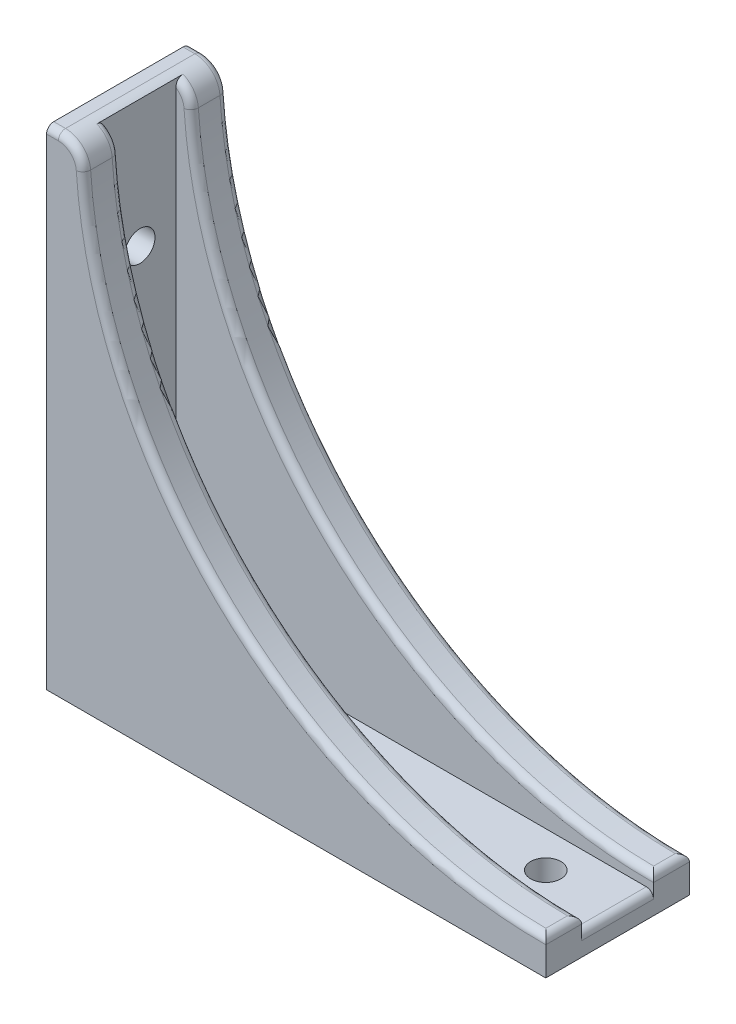
from build123d import *

# Parameters (mm, degrees)
BOSS_EXTRUDE1_DEPTH = 20
CUT_EXTRUDE1_DEPTH  = 15
BOSS_EXTRUDE2_DEPTH = 5
CUT_EXTRUDE2_REACH  = 101.269
SKETCH2_R           = 2.100000000000004
CUT_EXTRUDE3_REACH  = 101.269
SKETCH3_R           = 2.100000000000001
SKETCH3_R_2         = 2.099999999999995
FILLET2_R           = 64
FILLET3_START       = -1
FILLET3_DEPTH       = 22
FILLET3_START_2     = 2.0548
FILLET3_2_DEPTH     = 16
FILLET4_R           = 1


with BuildPart() as part:
    # Sketch1 → Boss-Extrude1 (new body)
    with BuildSketch(Plane.XY):
        Polygon((69.5, 5.000000000000004), (5, 5), (5.000000000000004, 67.99999999999999), (0, 68), (0, 0), (69.49999999999999, 0), align=None)
    extrude(amount=BOSS_EXTRUDE1_DEPTH)

    # Sketch1<3> → Cut-Extrude1 (cut)
    with BuildSketch(Plane.XY):
        Polygon((69.5, 5.000000000000004), (5, 5), (5.000000000000004, 67.99999999999999), (3.0000000000000027, 68), (3.000000000000001, 3), (69.5, 3.000000000000002), align=None)
    extrude(amount=CUT_EXTRUDE1_DEPTH, mode=Mode.SUBTRACT)

    # Sketch1<4> → Boss-Extrude2 (add)
    with BuildSketch(Plane.XY):
        Polygon((69.5, 5.000000000000004), (5, 5), (5.000000000000004, 67.99999999999999), (3.0000000000000027, 68), (3.000000000000001, 3), (69.5, 3.000000000000002), align=None)
    extrude(amount=BOSS_EXTRUDE2_DEPTH)

    # Sketch2 → Cut-Extrude2 (cut, up to next)
    with BuildSketch(Plane.XZ, mode=Mode.PRIVATE) as cut_extrude2_sk1:
        with Locations(Location((59.5, 10, 0), (0, 0, 270))):
            Circle(SKETCH2_R)
    cut_extrude2_tool1 = extrude(cut_extrude2_sk1.sketch, amount=-CUT_EXTRUDE2_REACH, mode=Mode.PRIVATE) & part.part
    add(cut_extrude2_tool1.solids().sort_by_distance((59.5, 0, 10))[0], mode=Mode.SUBTRACT)

    # Sketch3 → Cut-Extrude3 (cut, up to next)
    with BuildSketch(Plane.ZY, mode=Mode.PRIVATE) as cut_extrude3_sk1:
        with Locations((10, 24.999999999999996)):
            Circle(SKETCH3_R)
    cut_extrude3_tool1 = extrude(cut_extrude3_sk1.sketch, amount=-CUT_EXTRUDE3_REACH, mode=Mode.PRIVATE) & part.part
    # Sketch3 → Cut-Extrude3 (cut, up to next)
    with BuildSketch(Plane.ZY, mode=Mode.PRIVATE) as cut_extrude3_sk2:
        with Locations((10, 50)):
            Circle(SKETCH3_R_2)
    cut_extrude3_tool2 = extrude(cut_extrude3_sk2.sketch, amount=-CUT_EXTRUDE3_REACH, mode=Mode.PRIVATE) & part.part
    add(cut_extrude3_tool1.solids().sort_by_distance((0, 25, 10))[0], mode=Mode.SUBTRACT)
    add(cut_extrude3_tool2.solids().sort_by_distance((0, 50, 10))[0], mode=Mode.SUBTRACT)

    # Fillet2
    # the kernel refuses this fillet: 64 mm, written as the material it adds along each edge
    with BuildSketch(Plane(origin=(5.000000000000001, 5, -144.98046755776159), x_dir=(1, 0, 0), z_dir=(0, 0, 1))) as fillet2_piece_1_section:
        with BuildLine():
            CenterArc((63.992187023104634, 64), FILLET2_R, 180.89528298657015, 89.10471701342988)
            Line((6.22e-15, 62.999999999999986), (-1.2798437404620864, 62.97999999999999))
            ThreePointArc((-1.2798437404620864, 62.97999999999999), (-1.2799999999999976, 31.499999999999993), (-1.2800000000000002, 0))
            Line((-1.2800000000000002, 0), (0, -1.2800000000000002))
            Line((0, -1.2800000000000002), (63.992187023104634, -1.2800000000000002))
            Line((63.992187023104634, -1.2800000000000002), (63.992187023104634, 0))
        make_face()
    fillet2_piece_1 = extrude(amount=164.98046755776159, mode=Mode.PRIVATE)
    fillet2_piece_1 = split(fillet2_piece_1, bisect_by=Plane(origin=(5.000000000000001, 5, 0), z_dir=(0, 0, 1)), keep=Keep.TOP, mode=Mode.PRIVATE)
    fillet2_piece_1 = split(fillet2_piece_1, bisect_by=Plane(origin=(5.000000000000001, 5, 5), z_dir=(0, 0, -1)), keep=Keep.TOP, mode=Mode.PRIVATE)
    add(fillet2_piece_1)
    with BuildSketch(Plane(origin=(5.000000000000001, 5, 15), x_dir=(1, 0, 0), z_dir=(0, 0, 1))) as fillet2_piece_2:
        with BuildLine():
            CenterArc((63.992187023104634, 64), FILLET2_R, 180.89528298657015, 89.10471701342988)
            Line((6.22e-15, 62.999999999999986), (-1.2798437404620864, 62.97999999999999))
            ThreePointArc((-1.2798437404620864, 62.97999999999999), (-1.2799999999999976, 31.499999999999993), (-1.2800000000000002, 0))
            Line((-1.2800000000000002, 0), (0, -1.2800000000000002))
            Line((0, -1.2800000000000002), (63.992187023104634, -1.2800000000000002))
            Line((63.992187023104634, -1.2800000000000002), (63.992187023104634, 0))
        make_face()
    extrude(amount=5)
    with BuildSketch(Plane(origin=(5.000000000000001, 5, 0), x_dir=(1, 0, 0), z_dir=(0, 0, 1))) as fillet2_piece_3:
        with BuildLine():
            CenterArc((63.992187023104634, 64), FILLET2_R, 180.89528298657012, 89.10471701342988)
            Line((6.22e-15, 63), (-1.2798437404620864, 62.980000000000004))
            ThreePointArc((-1.2798437404620864, 62.980000000000004), (-1.2799999999999976, 31.5), (-1.2800000000000002, 0))
            Line((-1.2800000000000002, 0), (0, -1.2800000000000002))
            Line((0, -1.2800000000000002), (63.992187023104634, -1.2800000000000002))
            Line((63.992187023104634, -1.2800000000000002), (63.992187023104634, 0))
        make_face()
    extrude(amount=5)
    with BuildSketch(Plane(origin=(5.000000000000001, 5, 0), x_dir=(1, 0, 0), z_dir=(0, 0, 1))) as fillet2_piece_4_section:
        with BuildLine():
            CenterArc((63.992187023104634, 64), FILLET2_R, 180.89528298657012, 89.10471701342988)
            Line((6.22e-15, 63), (-1.2798437404620864, 62.980000000000004))
            ThreePointArc((-1.2798437404620864, 62.980000000000004), (-1.2799999999999976, 31.5), (-1.2800000000000002, 0))
            Line((-1.2800000000000002, 0), (0, -1.2800000000000002))
            Line((0, -1.2800000000000002), (63.992187023104634, -1.2800000000000002))
            Line((63.992187023104634, -1.2800000000000002), (63.992187023104634, 0))
        make_face()
    fillet2_piece_4 = extrude(amount=164.98046755776159, mode=Mode.PRIVATE)
    fillet2_piece_4 = split(fillet2_piece_4, bisect_by=Plane(origin=(5.000000000000001, 5, 15), z_dir=(0, 0, 1)), keep=Keep.TOP, mode=Mode.PRIVATE)
    fillet2_piece_4 = split(fillet2_piece_4, bisect_by=Plane(origin=(5.000000000000001, 5, 20), z_dir=(0, 0, -1)), keep=Keep.TOP, mode=Mode.PRIVATE)
    add(fillet2_piece_4)

    # Fillet3: read off the stored shape, not the designer's step
    # Fillet3 outline → Fillet3 (cut)
    with BuildSketch(Plane.XY.offset(FILLET3_START)):
        with BuildLine():
            ThreePointArc((5.134567622, 64.733333333), (5.046420717, 66.365807229), (5, 68))
            Line((5, 68), (1.642354061, 68))
            ThreePointArc((1.642354061, 68), (4.03330924, 67.056038602), (5.134567622, 64.733333333))
        make_face()
    extrude(amount=FILLET3_DEPTH, mode=Mode.SUBTRACT)

    # Fillet3 2 outline → Fillet3 2 (add)
    with BuildSketch(Plane.XY.offset(FILLET3_START_2)):
        with BuildLine():
            ThreePointArc((6.5, 3), (4.025126266, 4.025126266), (3, 6.5))
            Line((3, 6.5), (3, 3))
            Line((3, 3), (6.5, 3))
        make_face()
    extrude(amount=FILLET3_2_DEPTH)

    # Fillet4
    # the kernel refuses this fillet: 1 mm, written as the material it takes off along each edge
    with BuildSketch(Plane(origin=(1.6423540609999998, 68, 0), x_dir=(0, 0, 1), z_dir=(-1, 0, 0))) as fillet4_piece_1:
        with BuildLine():
            CenterArc((FILLET4_R, -FILLET4_R), FILLET4_R, 90, 90)
            Line((-1.1e-16, -FILLET4_R), (0, 0))
            Line((0, 0), (FILLET4_R, 0))
        make_face()
    extrude(amount=4.142354061, mode=Mode.SUBTRACT)
    with BuildSketch(Plane(origin=(1.6423540609999998, 68, 20), x_dir=(-2.84e-15, -1, 0), z_dir=(-1, 2.84e-15, 0))) as fillet4_piece_2:
        with BuildLine():
            CenterArc((FILLET4_R, -FILLET4_R), FILLET4_R, 90, 90)
            Line((0, -FILLET4_R), (0, 0))
            Line((0, 0), (FILLET4_R, 0))
        make_face()
    extrude(amount=4.142354061, mode=Mode.SUBTRACT)
    with BuildSketch(Plane(origin=(68.992187023105, 69, 0), x_dir=(-2.2e-16, -1, 0), z_dir=(1, -2.2e-16, 0))) as fillet4_piece_3:
        with BuildLine():
            CenterArc((64 + FILLET4_R, -FILLET4_R), FILLET4_R, 90, 90)
            Line((64, -FILLET4_R), (64, 0))
            Line((64, 0), (64 + FILLET4_R, 0))
        make_face()
    revolve(axis=Axis((68.992187023105, 69, 0), (0, 0, -1)), revolution_arc=86.1774462704384, mode=Mode.SUBTRACT)
    with BuildSketch(Plane(origin=(68.992187023105, 69, 15), x_dir=(-0.9977753031393836, -0.06666666667166976, 0), z_dir=(-0.06666666667166976, 0.9977753031393836, 0))) as fillet4_piece_4:
        with BuildLine():
            CenterArc((64.00000000000001 + FILLET4_R, FILLET4_R), FILLET4_R, 180, 90)
            Line((64.00000000000001 + FILLET4_R, 0), (64.00000000000001, 0))
            Line((64.00000000000001, 0), (64, FILLET4_R))
        make_face()
    revolve(axis=Axis((68.992187023105, 69, 15), (0, 0, 1)), revolution_arc=86.17744627043835, mode=Mode.SUBTRACT)
    with BuildSketch(Plane(origin=(68.992187023105, 69, 20), x_dir=(-0.9977753031393836, -0.06666666667166976, 0), z_dir=(-0.06666666667166976, 0.9977753031393836, 0))) as fillet4_piece_5:
        with BuildLine():
            CenterArc((64.00000000000001 + FILLET4_R, -FILLET4_R), FILLET4_R, 90, 90)
            Line((64.00000000000001 + FILLET4_R, 0), (64.00000000000001, 0))
            Line((64.00000000000001, 0), (64, -FILLET4_R))
        make_face()
    revolve(axis=Axis((68.992187023105, 69, 20), (0, 0, 1)), revolution_arc=86.17744627043835, mode=Mode.SUBTRACT)
    with BuildSketch(Plane(origin=(69.5, 3.0000000000000027, 5), x_dir=(-1, -4.4e-16, 0), z_dir=(0, 0, 1))) as fillet4_piece_6:
        with BuildLine():
            CenterArc((FILLET4_R, FILLET4_R), FILLET4_R, 179.99999999999983, 90.00000000000011)
            Line((4.4e-16, FILLET4_R), (0, 0))
            Line((0, 0), (FILLET4_R, 0))
        make_face()
    extrude(amount=10, mode=Mode.SUBTRACT)
    with BuildSketch(Plane(origin=(68.992187023105, 69, 5), x_dir=(6.7e-16, -1, 0), z_dir=(1, 6.7e-16, 0))) as fillet4_piece_7:
        with BuildLine():
            CenterArc((64 + FILLET4_R, FILLET4_R), FILLET4_R, 180, 90)
            Line((64 + FILLET4_R, 0), (64, 0))
            Line((64, 0), (64, FILLET4_R))
        make_face()
    revolve(axis=Axis((68.992187023105, 69, 5), (0, 0, -1)), revolution_arc=86.17744627043844, mode=Mode.SUBTRACT)
    with BuildSketch(Plane(origin=(1.6423540620579629, 64.50000000114308, 0), x_dir=(-3.022750939428944e-10, 1.0, 0), z_dir=(-1.0, -3.022750939428944e-10, 0))) as fillet4_piece_8:
        with BuildLine():
            CenterArc((3.4999999988569215 - FILLET4_R, -FILLET4_R), FILLET4_R, 0, 90)
            Line((3.4999999988569215 - FILLET4_R, 0), (3.4999999988569215, 0))
            Line((3.4999999988569215, 0), (3.4999999988569215, -FILLET4_R))
        make_face()
    revolve(axis=Axis((1.6423540620579629, 64.50000000114308, 0), (0, 0, -1)), revolution_arc=86.17744631101748, mode=Mode.SUBTRACT)
    with BuildSketch(Plane(origin=(1.6423540620579629, 64.50000000114308, 20), x_dir=(-3.022750939428944e-10, 1.0, 0), z_dir=(-1.0, -3.022750939428944e-10, 0))) as fillet4_piece_9:
        with BuildLine():
            CenterArc((3.4999999988569215 - FILLET4_R, FILLET4_R), FILLET4_R, 270, 90)
            Line((3.4999999988569215, FILLET4_R), (3.4999999988569215, 0))
            Line((3.4999999988569215, 0), (3.4999999988569215 - FILLET4_R, 0))
        make_face()
    revolve(axis=Axis((1.6423540620579629, 64.50000000114308, 20), (0, 0, -1)), revolution_arc=86.17744631101748, mode=Mode.SUBTRACT)
    with BuildSketch(Plane(origin=(1.6423540620579629, 64.50000000114308, 15), x_dir=(-0.31084032918327265, 0.9504621453552133, 0), z_dir=(-0.9504621453552133, -0.31084032918327265, 0))) as fillet4_piece_10_section:
        with BuildLine():
            CenterArc((3.4999999988569215 - FILLET4_R, -FILLET4_R), FILLET4_R, 0, 90)
            Line((3.4999999988569215, -FILLET4_R), (3.4999999988569215, 0))
            Line((3.4999999988569215, 0), (3.4999999988569215 - FILLET4_R, 0))
        make_face()
    fillet4_piece_10 = revolve(axis=Axis((1.6423540620579629, 64.50000000114308, 15), (0, 0, -1)), revolution_arc=104.28732621151866, mode=Mode.PRIVATE)
    fillet4_piece_10 = split(fillet4_piece_10, bisect_by=Plane(origin=(3.0000000000000027, 64.50000000114308, 15), z_dir=(1, -3e-17, 0)), keep=Keep.TOP, mode=Mode.PRIVATE)
    add(fillet4_piece_10, mode=Mode.SUBTRACT)
    with BuildSketch(Plane(origin=(1.6423540620579629, 64.50000000114308, 5), x_dir=(-0.31084032918327265, 0.9504621453552133, 0), z_dir=(-0.9504621453552133, -0.31084032918327265, 0))) as fillet4_piece_11_section:
        with BuildLine():
            CenterArc((3.4999999988569215 - FILLET4_R, FILLET4_R), FILLET4_R, 270, 90)
            Line((3.4999999988569215 - FILLET4_R, 0), (3.4999999988569215, 0))
            Line((3.4999999988569215, 0), (3.499999998856922, FILLET4_R))
        make_face()
    fillet4_piece_11 = revolve(axis=Axis((1.6423540620579629, 64.50000000114308, 5), (0, 0, -1)), revolution_arc=104.28732621151866, mode=Mode.PRIVATE)
    fillet4_piece_11 = split(fillet4_piece_11, bisect_by=Plane(origin=(3.0000000000000027, 64.50000000114308, 5), z_dir=(1, -3e-17, 0)), keep=Keep.TOP, mode=Mode.PRIVATE)
    add(fillet4_piece_11, mode=Mode.SUBTRACT)
    with BuildSketch(Plane(origin=(69.5, 5.000000000000004, -2.4953413165722065), x_dir=(0, -1, 0), z_dir=(0, 0, 1))) as fillet4_piece_12:
        with BuildLine():
            CenterArc((0.9981365266288797, -1), FILLET4_R, 89.99999999999984, 89.56614602080991)
            Line((-0.00183480455002627, -0.992427891952218), (-0.10183193766791643, -0.9916706811474398))
            ThreePointArc((-0.10183193766791643, -0.9916706811474398), (-0.0999999999999952, -0.5078129768950106), (-0.09999999999999964, 0))
            Line((-0.09999999999999964, 0), (0, 0.09999999999999432))
            Line((0, 0.09999999999999432), (0.9981365266288824, 0.09999999999999432))
            Line((0.9981365266288824, 0.09999999999999432), (0.9981365266288824, 0))
        make_face()
    extrude(amount=9.990682633144413, mode=Mode.SUBTRACT)
    with BuildSketch(Plane(origin=(69.5, 5.000000000000004, 12.504658683427794), x_dir=(-0.9999982909664641, 0.0018488007331925382, 0), z_dir=(0, 0, 1))) as fillet4_piece_13:
        with BuildLine():
            CenterArc((0.9981529354241921, 0.9999836215132766), FILLET4_R, 180.10592853951772, 89.5661460208106)
            Line((-0.00184535554227194, 0.998134820780085), (-0.10184518463891266, 0.9979499407067657))
            Line((-0.10184518463891266, 0.9979499407067657), (-0.09999982909664072, -0.00018488007331924))
            Line((-0.09999982909664072, -0.00018488007331924), (0.00018488007331925, -0.09999982909664605))
            ThreePointArc((0.00018488007331925, -0.09999982909664605), (0.5079969890989224, -0.09906098409263343), (0.991857253310012, -0.09999836215132722))
            Line((0.991857253310012, -0.09999836215132722), (0.9924295880476661, 0))
        make_face()
    extrude(amount=9.990682633144415, mode=Mode.SUBTRACT)
    with BuildSketch(Plane(origin=(72, 5.000000000000004, 5), x_dir=(7e-17, -1, 0), z_dir=(-1, -7e-17, 0))) as fillet4_piece_14:
        with BuildLine():
            CenterArc((FILLET4_R, -FILLET4_R), FILLET4_R, 90, 90)
            Line((0, -FILLET4_R), (0, 0))
            Line((0, 0), (FILLET4_R, 0))
        make_face()
    extrude(amount=3.0078129768950106, mode=Mode.SUBTRACT)
    with BuildSketch(Plane(origin=(72, 5.000000000000004, 20), x_dir=(0, 0, -1), z_dir=(-1, -7e-17, 0))) as fillet4_piece_15:
        with BuildLine():
            CenterArc((FILLET4_R, FILLET4_R), FILLET4_R, 179.99999999999994, 90.00000000000006)
            Line((0, FILLET4_R), (0, 0))
            Line((0, 0), (FILLET4_R, 0))
        make_face()
    extrude(amount=3.0078129768950106, mode=Mode.SUBTRACT)
    with BuildSketch(Plane(origin=(72, 5.000000000000004, 15), x_dir=(7e-17, -1, 0), z_dir=(-1, -7e-17, 0))) as fillet4_piece_16:
        with BuildLine():
            CenterArc((FILLET4_R, FILLET4_R), FILLET4_R, 180, 90)
            Line((8.9e-16, FILLET4_R), (0, 0))
            Line((0, 0), (FILLET4_R, 0))
        make_face()
    extrude(amount=3.0078129768950106, mode=Mode.SUBTRACT)
    with BuildSketch(Plane(origin=(72, 5.000000000000004, 0), x_dir=(7e-17, -1, 0), z_dir=(-1, -7e-17, 0))) as fillet4_piece_17:
        with BuildLine():
            CenterArc((FILLET4_R, FILLET4_R), FILLET4_R, 180, 90)
            Line((0, FILLET4_R), (0, 0))
            Line((0, 0), (FILLET4_R, 0))
        make_face()
    extrude(amount=3.0078129768950106, mode=Mode.SUBTRACT)


solid = part.part
